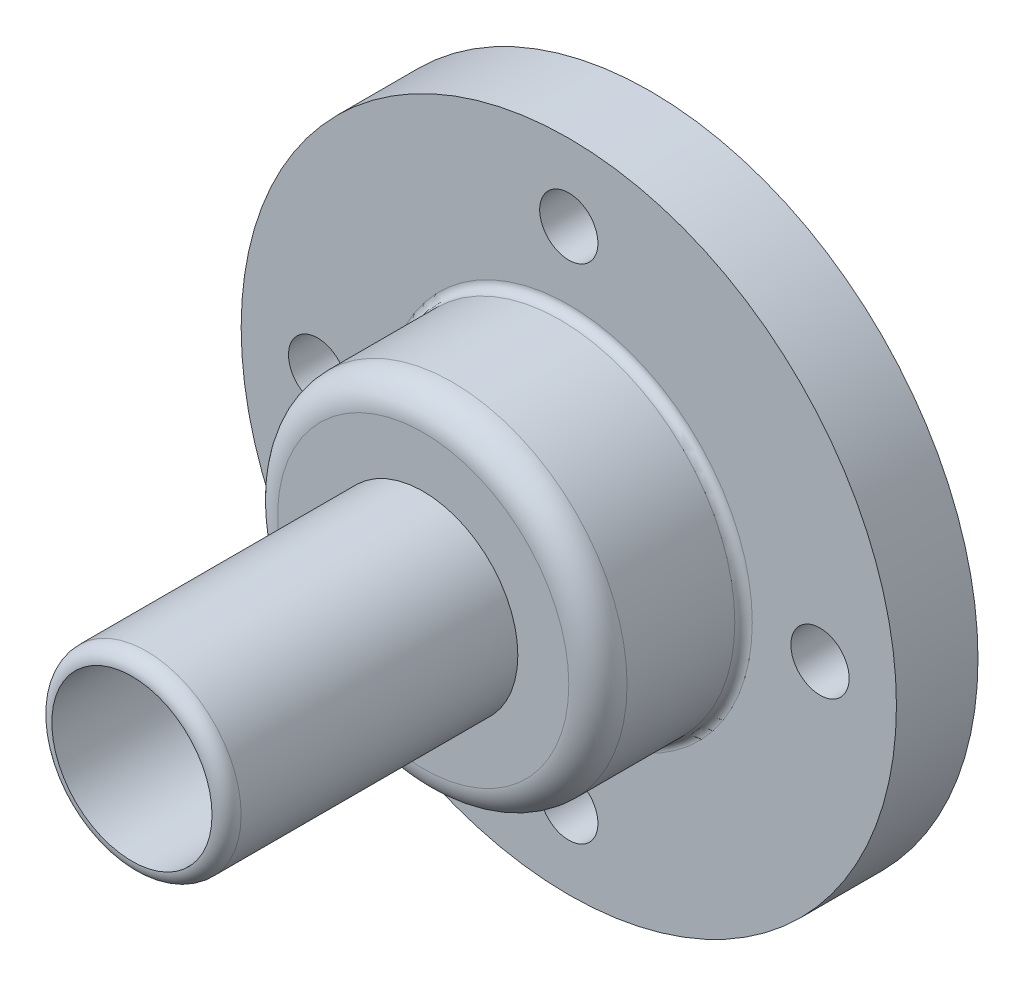
from build123d import *

# Parameters (mm, degrees)
SKETCH2_R           = 112.5
BOSS_EXTRUDE1_DEPTH = 28
SKETCH4_R           = 60
BOSS_EXTRUDE5_DEPTH = 50
FILLET2_R           = 3
FILLET3_R           = 10
SKETCH7_R           = 32.5
BOSS_EXTRUDE7_DEPTH = 100
SKETCH8_R           = 27.5
CUT_EXTRUDE1_DEPTH  = 239.73939767
SKETCH9_R           = 10
CUT_EXTRUDE2_DEPTH  = 219.660696057
FILLET4_R           = 5


with BuildPart() as part:
    # Sketch2 → Boss-Extrude1 (new body)
    with BuildSketch(Plane.XY):
        Circle(SKETCH2_R)
    extrude(amount=BOSS_EXTRUDE1_DEPTH)

    # Sketch4 → Boss-Extrude5 (add)
    with BuildSketch(Plane.XY.offset(28)):
        Circle(SKETCH4_R)
    extrude(amount=BOSS_EXTRUDE5_DEPTH)

    # Fillet2
    fillet2_edges = [part.edges().sort_by_distance(p)[0] for p in [
        (-60, 0, 28),
    ]]
    fillet(fillet2_edges, radius=FILLET2_R)

    # Fillet3
    fillet3_edges = [part.edges().sort_by_distance(p)[0] for p in [
        (-60, 0, 78),
    ]]
    fillet(fillet3_edges, radius=FILLET3_R)

    # Sketch7 → Boss-Extrude7 (add)
    with BuildSketch(Plane.XY.offset(78)):
        Circle(SKETCH7_R)
    extrude(amount=BOSS_EXTRUDE7_DEPTH)

    # Sketch8 → Cut-Extrude1 (cut, through all)
    with BuildSketch(Plane.XY.offset(178)):
        Circle(SKETCH8_R)
    extrude(amount=-CUT_EXTRUDE1_DEPTH, mode=Mode.SUBTRACT)

    # Sketch9 → Cut-Extrude2 (cut, through all)
    with BuildSketch(Plane.XY.offset(28)):
        with Locations((0, 86.25)):
            Circle(SKETCH9_R)
        with Locations((86.25, 0)):
            Circle(SKETCH9_R)
        with Locations((0, -86.25)):
            Circle(SKETCH9_R)
        with Locations((-86.25, 0)):
            Circle(SKETCH9_R)
    extrude(amount=-CUT_EXTRUDE2_DEPTH, mode=Mode.SUBTRACT)

    # Fillet4
    fillet4_edges = [part.edges().sort_by_distance(p)[0] for p in [
        (-32.5, 0, 178),
    ]]
    fillet(fillet4_edges, radius=FILLET4_R - 0.0001)  # a hair under: the kernel refuses the full size


solid = part.part
